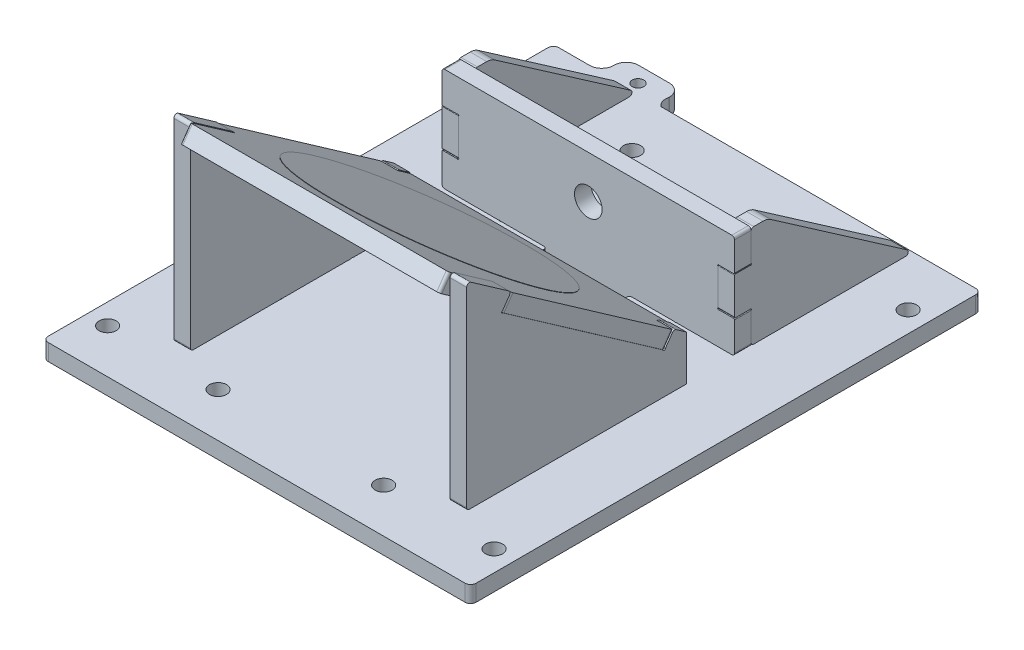
from build123d import *

# Parameters (mm, degrees)
BOSS_EXTRUDE1_DEPTH      = 6
BOSS_EXTRUDE2_DEPTH      = 6
SKETCH4_R                = 42
BOSS_EXTRUDE3_DEPTH      = 6
SKETCH3_R                = 3.1
SKETCH3_R_2              = 2.1
BOSS_EXTRUDE5_DEPTH      = 6
BOSS_EXTRUDE6_DEPTH      = 6
BODY_MOVE_COPY2_ANGLE    = 180
BODY_MOVE_COPY5_ANGLE    = 180
BODY_MOVE_COPY8_START    = 396.020080662
BODY_MOVE_COPY8_DEPTH    = 6
BODY_MOVE_COPY8_2_DEPTH  = 6
BODY_MOVE_COPY9_ANGLE    = 180
BODY_MOVE_COPY10_START   = 396.020080662
BODY_MOVE_COPY10_DEPTH   = 6
BODY_MOVE_COPY10_2_DEPTH = 6
BODY_MOVE_COPY15_ANGLE   = 90
BODY_MOVE_COPY17_ANGLE   = 35
SKETCH8_R                = 41.964596681
BOSS_EXTRUDE7_DEPTH      = 0.1
FILLET1_R                = 2
BODY_MOVE_COPY19_START   = 295.92104831
BODY_MOVE_COPY19_DEPTH   = 6
BODY_MOVE_COPY19_2_DEPTH = 6
BODY_MOVE_COPY20_START   = 374.882569364
BODY_MOVE_COPY20_DEPTH   = 6
BODY_MOVE_COPY20_2_DEPTH = 6
BODY_MOVE_COPY21_START   = 295.92104831
BODY_MOVE_COPY21_DEPTH   = 6
BODY_MOVE_COPY21_2_DEPTH = 6
BODY_MOVE_COPY22_START   = 396.020080662
BODY_MOVE_COPY22_DEPTH   = 6
BODY_MOVE_COPY22_2_DEPTH = 6


# Read off the part's stored shape, not the designer's step: Body-Move/Copy8, Body-Move/Copy10, Body-Move/Copy19, Body-Move/Copy20, Body-Move/Copy21, Body-Move/Copy22
with BuildPart() as part:
    # Sketch6 → Boss-Extrude1 (new body)
    with BuildSketch(Plane(origin=(259.180115074, 0, 0), x_dir=(0, 0, -1), z_dir=(1, 0, 0))):
        with BuildLine():
            Line((0, 229.491923688), (0, 216.402331063))
            ThreePointArc((0, 216.402331063), (-0.100890866, 216.158758965), (-0.344462964, 216.057868099))
            Line((-0.344462964, 216.057868099), (-5.417934935, 216.057868099))
            ThreePointArc((-5.417934935, 216.057868099), (-5.90507938, 216.057868099), (-5.90507938, 215.570723655))
            Line((-5.90507938, 215.570723655), (-5.90507938, 205.47793421))
            ThreePointArc((-5.90507938, 205.47793421), (-6.193338998, 204.782013932), (-6.889259276, 204.493754314))
            Line((-6.889259276, 204.493754314), (-61.889259165, 204.493754314))
            ThreePointArc((-61.889259165, 204.493754314), (-62.828563719, 205.184136264), (-62.450062585, 206.286704708))
            Line((-62.450062585, 206.286704708), (-13.075004127, 240.523454428))
            ThreePointArc((-13.075004127, 240.523454428), (-11.73997764, 241.176123509), (-10.270988993, 241.400500438))
            Line((-10.270988993, 241.400500438), (-6.889259276, 241.400500438))
            ThreePointArc((-6.889259276, 241.400500438), (-6.193338998, 241.11224082), (-5.90507938, 240.416320541))
            Line((-5.90507938, 240.416320541), (-5.90507938, 230.323531096))
            ThreePointArc((-5.90507938, 230.323531096), (-5.90507938, 229.836386652), (-5.417934935, 229.836386652))
            Line((-5.417934935, 229.836386652), (-0.344462964, 229.836386652))
            ThreePointArc((-0.344462964, 229.836386652), (-0.100890866, 229.735495786), (0, 229.491923688))
        make_face()
    extrude(amount=BOSS_EXTRUDE1_DEPTH)


with BuildPart() as body_2:
    # Sketch5 → Boss-Extrude2 (new body)
    with BuildSketch(Plane(origin=(256.769204052, 0, 0), x_dir=(0, 0, -1), z_dir=(1, 0, 0))):
        with BuildLine():
            Line((-12, 208.780869141), (-12, 277.928876141))
            ThreePointArc((-12, 277.928876141), (-12.538251537, 278.815887402), (-13.573577, 278.748028141))
            Line((-13.573577, 278.748028141), (-27.31886, 269.123477141))
            ThreePointArc((-27.31886, 269.123477141), (-27.730091296, 268.477973575), (-27.564436, 267.730749141))
            Line((-27.564436, 267.730749141), (-24.98046, 264.040448141))
            ThreePointArc((-24.98046, 264.040448141), (-24.696554, 263.634989141), (-25.102013, 263.351083141))
            Line((-25.102013, 263.351083141), (-83.270041, 222.621391141))
            ThreePointArc((-83.270041, 222.621391141), (-83.675501, 222.337485141), (-83.959407, 222.742945141))
            Line((-83.959407, 222.742945141), (-86.543383, 226.433245141))
            ThreePointArc((-86.543383, 226.433245141), (-87.188887016, 226.844476928), (-87.936112, 226.678821141))
            Line((-87.936112, 226.678821141), (-91.592045, 224.118909141))
            Line((-91.592045, 224.118909141), (-91.592045, 207.780869141))
            Line((-91.592045, 207.780869141), (-70.744975, 207.780869141))
            ThreePointArc((-70.744975, 207.780869141), (-70.25, 207.780869141), (-70.25, 207.285894141))
            Line((-70.25, 207.285894141), (-70.25, 202.780869141))
            ThreePointArc((-70.25, 202.780869141), (-69.957106781, 202.07376236), (-69.25, 201.780869141))
            Line((-69.25, 201.780869141), (-46.25, 201.780869141))
            ThreePointArc((-46.25, 201.780869141), (-45.542893219, 202.07376236), (-45.25, 202.780869141))
            Line((-45.25, 202.780869141), (-45.25, 207.285894141))
            ThreePointArc((-45.25, 207.285894141), (-45.2500005, 207.780868641), (-44.755026, 207.780869141))
            Line((-44.755026, 207.780869141), (-13, 207.780869141))
            ThreePointArc((-13, 207.780869141), (-12.292893219, 208.07376236), (-12, 208.780869141))
        make_face()
    extrude(amount=BOSS_EXTRUDE2_DEPTH)


with BuildPart() as body_3:
    # Sketch4 → Boss-Extrude3 (new body)
    # profile 1 of 2: a face of its own
    with BuildSketch(Plane(origin=(0, 97.256150076, 0), x_dir=(-1, 0, 0), z_dir=(0, 1, 0))):
        with BuildLine():
            Line((-113.209223251, -57.967223344), (-113.209223251, 34.032776656))
            ThreePointArc((-113.209223251, 34.032776656), (-113.502116469, 34.739883437), (-114.209223251, 35.032776656))
            Line((-114.209223251, 35.032776656), (-118.214249251, 35.032776656))
            ThreePointArc((-118.214249251, 35.032776656), (-118.709223751, 35.032777156), (-118.709223251, 35.527751656))
            Line((-118.709223251, 35.527751656), (-118.709223251, 40.032776656))
            ThreePointArc((-118.709223251, 40.032776656), (-119.002116469, 40.739883437), (-119.709223251, 41.032776656))
            Line((-119.709223251, 41.032776656), (-189.709223251, 41.032776656))
            ThreePointArc((-189.709223251, 41.032776656), (-190.416330032, 40.739883437), (-190.709223251, 40.032776656))
            Line((-190.709223251, 40.032776656), (-190.709223251, 35.527751656))
            ThreePointArc((-190.709223251, 35.527751656), (-190.709223251, 35.032776656), (-191.204198251, 35.032776656))
            Line((-191.204198251, 35.032776656), (-209.709223251, 35.032776656))
            ThreePointArc((-209.709223251, 35.032776656), (-210.416330032, 34.739883437), (-210.709223251, 34.032776656))
            Line((-210.709223251, 34.032776656), (-210.709223251, -57.967223344))
            ThreePointArc((-210.709223251, -57.967223344), (-210.416330032, -58.674330125), (-209.709223251, -58.967223344))
            Line((-209.709223251, -58.967223344), (-191.204198251, -58.967223344))
            ThreePointArc((-191.204198251, -58.967223344), (-190.709223751, -58.967222844), (-190.709223251, -59.462197344))
            Line((-190.709223251, -59.462197344), (-190.709223251, -63.967223344))
            ThreePointArc((-190.709223251, -63.967223344), (-190.416330032, -64.674330125), (-189.709223251, -64.967223344))
            Line((-189.709223251, -64.967223344), (-119.709223251, -64.967223344))
            ThreePointArc((-119.709223251, -64.967223344), (-119.002116469, -64.674330125), (-118.709223251, -63.967223344))
            Line((-118.709223251, -63.967223344), (-118.709223251, -59.462197344))
            ThreePointArc((-118.709223251, -59.462197344), (-118.709223251, -58.967223344), (-118.214249251, -58.967223344))
            Line((-118.214249251, -58.967223344), (-114.209223251, -58.967223344))
            ThreePointArc((-114.209223251, -58.967223344), (-113.502116469, -58.674330125), (-113.209223251, -57.967223344))
        make_face()
        with Locations((-161.959223251, -11.967223344)):
            Circle(SKETCH4_R, mode=Mode.SUBTRACT)
    # profile 2 of 2: a face of its own
    with BuildSketch(Plane(origin=(0, 97.256150076, 0), x_dir=(-1, 0, 0), z_dir=(0, 1, 0))):
        with Locations((-161.959223251, -11.967223344)):
            Circle(SKETCH4_R)
    extrude(amount=BOSS_EXTRUDE3_DEPTH)


with BuildPart() as body_4:
    # Sketch3 → Boss-Extrude5 (new body)
    with BuildSketch(Plane(origin=(-0.811032021, 207.780869141, 0), x_dir=(1, 0, 0), z_dir=(0, -1, 0))):
        with BuildLine():
            Line((272.134893953, -56), (272.134893953, -59))
            Line((272.134893953, -59), (285.234893953, -59))
            ThreePointArc((285.234893953, -59), (288.34616379, -60.288730163), (289.634893953, -63.4))
            Line((289.634893953, -63.4), (289.634893953, -63.530837911))
            ThreePointArc((289.634893953, -63.530837911), (290.923624116, -66.642107748), (294.034893953, -67.930837911))
            Line((294.034893953, -67.930837911), (299.634893953, -67.930837911))
            Line((299.634893953, -67.930837911), (305.234893953, -67.930837911))
            ThreePointArc((305.234893953, -67.930837911), (308.34616379, -66.642107748), (309.634893953, -63.530837911))
            Line((309.634893953, -63.530837911), (309.634893953, -63.4))
            ThreePointArc((309.634893953, -63.4), (309.711360462, -61.00160298), (311.034893953, -59))
            Line((311.034893953, -59), (427.134893953, -59))
            Line((427.134893953, -59), (427.134893953, -56))
            Line((427.134893953, -56), (427.134893953, 126))
            Line((427.134893953, 126), (272.134893953, 126))
            Line((272.134893953, 126), (272.134893953, -56))
        make_face()
        with Locations(Location((419.634893953, -40, 0), (0, 0, 270))):
            Circle(SKETCH3_R, mode=Mode.SUBTRACT)
        with Locations(Location((379.634893953, -40, 0), (0, 0, 270))):
            Circle(SKETCH3_R, mode=Mode.SUBTRACT)
        with Locations(Location((319.634893953, -40, 0), (0, 0, 270))):
            Circle(SKETCH3_R, mode=Mode.SUBTRACT)
        with Locations(Location((279.634893953, -40, 0), (0, 0, 270))):
            Circle(SKETCH3_R, mode=Mode.SUBTRACT)
        with Locations(Location((279.634893953, 110, 0), (0, 0, 270))):
            Circle(SKETCH3_R, mode=Mode.SUBTRACT)
        with Locations(Location((319.634893953, 110, 0), (0, 0, 270))):
            Circle(SKETCH3_R, mode=Mode.SUBTRACT)
        with Locations(Location((379.634893953, 110, 0), (0, 0, 270))):
            Circle(SKETCH3_R, mode=Mode.SUBTRACT)
        with Locations(Location((419.634893953, 110, 0), (0, 0, 270))):
            Circle(SKETCH3_R, mode=Mode.SUBTRACT)
        with Locations(Location((299.634893953, -62.135677, 0), (0, 0, 270))):
            Circle(SKETCH3_R_2, mode=Mode.SUBTRACT)
        with BuildLine():
            Line((318.129868953, 6), (333.634893953, 6))
            ThreePointArc((333.634893953, 6), (334.342000734, 6.292893219), (334.634893953, 7))
            Line((334.634893953, 7), (334.634893953, 22))
            ThreePointArc((334.634893953, 22), (335.220680391, 23.414213562), (336.634893953, 24))
            Line((336.634893953, 24), (362.634893953, 24))
            ThreePointArc((362.634893953, 24), (364.049107515, 23.414213562), (364.634893953, 22))
            Line((364.634893953, 22), (364.634893953, 7))
            ThreePointArc((364.634893953, 7), (364.927787172, 6.292893219), (365.634893953, 6))
            Line((365.634893953, 6), (381.139918953, 6))
            ThreePointArc((381.139918953, 6), (381.634893953, 6), (381.634893953, 5.505025))
            Line((381.634893953, 5.505025), (381.634893953, 0.494975))
            ThreePointArc((381.634893953, 0.494975), (381.634893953, 0), (381.139918953, 0))
            Line((381.139918953, 0), (318.129868953, 0))
            ThreePointArc((318.129868953, 0), (317.634893953, 0), (317.634893953, 0.494975))
            Line((317.634893953, 0.494975), (317.634893953, 5.505025))
            ThreePointArc((317.634893953, 5.505025), (317.634893953, 6), (318.129868953, 6))
        make_face(mode=Mode.SUBTRACT)
        with BuildLine():
            Line((402.139918953, 45.25), (397.129868953, 45.25))
            ThreePointArc((397.129868953, 45.25), (396.634893953, 45.25), (396.634893953, 45.744975))
            Line((396.634893953, 45.744975), (396.634893953, 69.755025))
            ThreePointArc((396.634893953, 69.755025), (396.634893953, 70.25), (397.129868953, 70.25))
            Line((397.129868953, 70.25), (402.139918953, 70.25))
            ThreePointArc((402.139918953, 70.25), (402.634893953, 70.25), (402.634893953, 69.755025))
            Line((402.634893953, 69.755025), (402.634893953, 45.744975))
            ThreePointArc((402.634893953, 45.744975), (402.634893953, 45.25), (402.139918953, 45.25))
        make_face(mode=Mode.SUBTRACT)
        with BuildLine():
            Line((297.129869326, 45.25), (302.13991858, 45.25))
            ThreePointArc((302.13991858, 45.25), (302.634893953, 45.249999627), (302.634894326, 45.744975))
            Line((302.634894326, 45.744975), (302.634894326, 69.755025))
            ThreePointArc((302.634894326, 69.755025), (302.634894326, 70.25), (302.139919326, 70.25))
            Line((302.139919326, 70.25), (297.129869326, 70.25))
            ThreePointArc((297.129869326, 70.25), (296.634894326, 70.25), (296.634894326, 69.755025))
            Line((296.634894326, 69.755025), (296.634894326, 45.744975))
            ThreePointArc((296.634894326, 45.744975), (296.634894326, 45.25), (297.129869326, 45.25))
        make_face(mode=Mode.SUBTRACT)
    extrude(amount=BOSS_EXTRUDE5_DEPTH)

    # Fillet1
    fillet1_edges = [body_4.edges().sort_by_distance(p)[0] for p in [
        (271.323861932, 204.780869141, -59),
        (271.323861932, 204.780869141, 126),
        (426.323861932, 204.780869141, 126),
        (426.323861932, 204.780869141, -59),
    ]]
    fillet(fillet1_edges, radius=FILLET1_R)


with BuildPart() as body_5:
    # Sketch2 → Boss-Extrude6 (new body)
    with BuildSketch(Plane(origin=(14.444060441, 0, 0), x_dir=(1, 0, 0), z_dir=(0, 0, 1))):
        with BuildLine():
            Line((334.511507872, 164.280869297), (303.511507872, 164.280869297))
            ThreePointArc((303.511507872, 164.280869297), (302.804401091, 164.573762516), (302.511507872, 165.280869297))
            Line((302.511507872, 165.280869297), (302.511507872, 175.680869297))
            ThreePointArc((302.511507872, 175.680869297), (302.614020499, 175.928356671), (302.861507872, 176.030869297))
            Line((302.861507872, 176.030869297), (308.016532872, 176.030869297))
            ThreePointArc((308.016532872, 176.030869297), (308.511507372, 176.030868797), (308.511507872, 176.525843297))
            Line((308.511507872, 176.525843297), (308.511507872, 189.535894297))
            ThreePointArc((308.511507872, 189.535894297), (308.511507872, 190.030869297), (308.016532872, 190.030869297))
            Line((308.016532872, 190.030869297), (302.861507872, 190.030869297))
            ThreePointArc((302.861507872, 190.030869297), (302.614020499, 190.133381924), (302.511507872, 190.380869297))
            Line((302.511507872, 190.380869297), (302.511507872, 207.285894297))
            ThreePointArc((302.511507872, 207.285894297), (302.511507872, 207.780869044), (302.016533125, 207.780869044))
            Line((302.016533125, 207.780869044), (282.511507872, 207.780869297))
            ThreePointArc((282.511507872, 207.780869297), (281.804401091, 208.073762516), (281.511507872, 208.780869297))
            Line((281.511507872, 208.780869297), (281.511507872, 219.180869297))
            ThreePointArc((281.511507872, 219.180869297), (281.614020499, 219.428356671), (281.861507872, 219.530869297))
            Line((281.861507872, 219.530869297), (287.016532872, 219.530869297))
            ThreePointArc((287.016532872, 219.530869297), (287.511507372, 219.530868797), (287.511507872, 220.025843297))
            Line((287.511507872, 220.025843297), (287.511507872, 233.035894297))
            ThreePointArc((287.511507872, 233.035894297), (287.511507872, 233.530869297), (287.016532872, 233.530869297))
            Line((287.016532872, 233.530869297), (281.861507872, 233.530869297))
            ThreePointArc((281.861507872, 233.530869297), (281.614020499, 233.633381924), (281.511507872, 233.880869297))
            Line((281.511507872, 233.880869297), (281.511507872, 244.280869297))
            ThreePointArc((281.511507872, 244.280869297), (281.804401091, 244.987976079), (282.511507872, 245.280869297))
            Line((282.511507872, 245.280869297), (386.511507872, 245.280869297))
            ThreePointArc((386.511507872, 245.280869297), (387.218614653, 244.987976079), (387.511507872, 244.280869297))
            Line((387.511507872, 244.280869297), (387.511507872, 233.880869297))
            ThreePointArc((387.511507872, 233.880869297), (387.408995246, 233.633381924), (387.161507872, 233.530869297))
            Line((387.161507872, 233.530869297), (382.006481872, 233.530869297))
            ThreePointArc((382.006481872, 233.530869297), (381.511507372, 233.530868797), (381.511507872, 233.035894297))
            Line((381.511507872, 233.035894297), (381.511507872, 220.025843297))
            ThreePointArc((381.511507872, 220.025843297), (381.511507872, 219.530869297), (382.006481872, 219.530869297))
            Line((382.006481872, 219.530869297), (387.161507872, 219.530869297))
            ThreePointArc((387.161507872, 219.530869297), (387.408995246, 219.428356671), (387.511507872, 219.180869297))
            Line((387.511507872, 219.180869297), (387.511507872, 208.780869297))
            ThreePointArc((387.511507872, 208.780869297), (387.218614653, 208.073762516), (386.511507872, 207.780869297))
            Line((386.511507872, 207.780869297), (367.006482246, 207.780868671))
            ThreePointArc((367.006482246, 207.780868671), (366.511507872, 207.780868671), (366.511507872, 207.285894297))
            Line((366.511507872, 207.285894297), (366.511507872, 190.380869297))
            ThreePointArc((366.511507872, 190.380869297), (366.408995246, 190.133381924), (366.161507872, 190.030869297))
            Line((366.161507872, 190.030869297), (361.006481872, 190.030869297))
            ThreePointArc((361.006481872, 190.030869297), (360.511507372, 190.030868797), (360.511507872, 189.535894297))
            Line((360.511507872, 189.535894297), (360.511507872, 176.525843297))
            ThreePointArc((360.511507872, 176.525843297), (360.511507872, 176.030869297), (361.006481872, 176.030869297))
            Line((361.006481872, 176.030869297), (366.161507872, 176.030869297))
            ThreePointArc((366.161507872, 176.030869297), (366.408995246, 175.928356671), (366.511507872, 175.680869297))
            Line((366.511507872, 175.680869297), (366.511507872, 165.280869297))
            ThreePointArc((366.511507872, 165.280869297), (366.218614653, 164.573762516), (365.511507872, 164.280869297))
            Line((365.511507872, 164.280869297), (334.511507872, 164.280869297))
        make_face()
        with BuildLine():
            ThreePointArc((339.511507872, 229.780869297), (334.511507872, 234.780869297), (329.511507872, 229.780869297))
            ThreePointArc((329.511507872, 229.780869297), (330.975973966, 226.245335392), (334.511507872, 224.780869297))
            ThreePointArc((334.511507872, 224.780869297), (338.047041778, 226.245335392), (339.511507872, 229.780869297))
        make_face(mode=Mode.SUBTRACT)
        with BuildLine():
            ThreePointArc((339.511507872, 179.780869297), (334.511507872, 184.780869297), (329.511507872, 179.780869297))
            ThreePointArc((329.511507872, 179.780869297), (330.975973966, 176.245335392), (334.511507872, 174.780869297))
            ThreePointArc((334.511507872, 174.780869297), (338.047041778, 176.245335392), (339.511507872, 179.780869297))
        make_face(mode=Mode.SUBTRACT)
    extrude(amount=BOSS_EXTRUDE6_DEPTH)


with BuildPart() as body_2_1:
    # Body-Move/Copy1: moved
    add(body_2.part.moved(Location((39.090347222, 0, 0))))


with BuildPart() as body_2_2:
    # Body-Move/Copy2: moved
    add(body_2_1.part.rotate(Axis((298.859551273, 0, 51.7960225), (0, 1, 0)), BODY_MOVE_COPY2_ANGLE))


with BuildPart() as body_2_3:
    # Body-Move/Copy3: moved
    add(body_2_2.part.moved(Location((0, 0, 11.447860124))))


with BuildPart() as body_6:
    # Body-Move/Copy4: copy of body 2
    add(body_2_3.part.moved(Location((100.069066196, 0, 0))))


with BuildPart() as part_1:
    # Body-Move/Copy5: moved
    add(part.part.rotate(Axis((262.180115074, 0, 31.942046057), (0, 1, 0)), BODY_MOVE_COPY5_ANGLE))


with BuildPart() as body_7:
    # Body-Move/Copy6: copy of part
    add(part_1.part.moved(Location((36.740933236, 0, -58.148617023))))

    # Body-Move/Copy19 outline → Body-Move/Copy19 (cut)
    with BuildSketch(Plane.YZ.offset(BODY_MOVE_COPY19_START)):
        with BuildLine():
            ThreePointArc((216.13235483, 0.206230387), (216.152186866, 0.405459508), (216.057868099, 0.582065064))
            Line((216.057868099, 0.582065064), (216.057868099, 0.317540155))
            ThreePointArc((216.057868099, 0.317540155), (216.10057347, 0.265540359), (216.13235483, 0.206230387))
        make_face()
        with BuildLine():
            Line((229.836386652, 0.317540155), (229.836386652, 0.582065064))
            ThreePointArc((229.836386652, 0.582065064), (229.742067885, 0.405459508), (229.761899921, 0.206230387))
            ThreePointArc((229.761899921, 0.206230387), (229.793681281, 0.265540359), (229.836386652, 0.317540155))
        make_face()
        with BuildLine():
            ThreePointArc((206.286704708, -56.450062585), (205.184136264, -56.828563719), (204.493754314, -55.889259165))
            Line((204.493754314, -55.889259165), (204.493754314, -56.153784074))
            ThreePointArc((204.493754314, -56.153784074), (205.184136264, -57.093088628), (206.286704708, -56.714587494))
            Line((206.286704708, -56.714587494), (240.523454428, -7.339529036))
            ThreePointArc((240.523454428, -7.339529036), (241.176123509, -6.004502549), (241.400500438, -4.535513903))
            Line((241.400500438, -4.535513903), (241.400500438, -4.270988993))
            ThreePointArc((241.400500438, -4.270988993), (241.176123509, -5.73997764), (240.523454428, -7.075004127))
            Line((240.523454428, -7.075004127), (206.286704708, -56.450062585))
        make_face()
    extrude(amount=BODY_MOVE_COPY19_DEPTH, mode=Mode.SUBTRACT)

    # Body-Move_Copy19 2 outline → Body-Move_Copy19 2 (add)
    with BuildSketch(Plane.YZ.offset(BODY_MOVE_COPY19_START)):
        with BuildLine():
            Line((229.491923688, 6), (216.402331063, 6))
            ThreePointArc((216.402331063, 6), (216.158758965, 5.899109134), (216.057868099, 5.655537036))
            Line((216.057868099, 5.655537036), (216.057868099, 5.391012127))
            ThreePointArc((216.057868099, 5.391012127), (216.158758965, 5.634584225), (216.402331063, 5.735475091))
            Line((216.402331063, 5.735475091), (229.491923688, 5.735475091))
            ThreePointArc((229.491923688, 5.735475091), (229.735495786, 5.634584225), (229.836386652, 5.391012127))
            Line((229.836386652, 5.391012127), (229.836386652, 5.655537036))
            ThreePointArc((229.836386652, 5.655537036), (229.735495786, 5.899109134), (229.491923688, 6))
        make_face()
        with BuildLine():
            ThreePointArc((215.570723655, -0.169604289), (216.005868303, -0.21230966), (216.13235483, 0.206230387))
            ThreePointArc((216.13235483, 0.206230387), (215.881262543, 0.000601853), (215.570723655, 0.09492062))
            Line((215.570723655, 0.09492062), (205.47793421, 0.09492062))
            ThreePointArc((205.47793421, 0.09492062), (204.782013932, -0.193338998), (204.493754314, -0.889259277))
            Line((204.493754314, -0.889259277), (204.493754314, -1.153784186))
            ThreePointArc((204.493754314, -1.153784186), (204.782013932, -0.457863907), (205.47793421, -0.169604289))
            Line((205.47793421, -0.169604289), (215.570723655, -0.169604289))
        make_face()
        with BuildLine():
            ThreePointArc((230.323531096, 0.09492062), (230.012992208, 0.000601853), (229.761899921, 0.206230387))
            ThreePointArc((229.761899921, 0.206230387), (229.888386448, -0.21230966), (230.323531096, -0.169604289))
            Line((230.323531096, -0.169604289), (240.416320541, -0.169604289))
            ThreePointArc((240.416320541, -0.169604289), (241.11224082, -0.457863907), (241.400500438, -1.153784186))
            Line((241.400500438, -1.153784186), (241.400500438, -0.889259277))
            ThreePointArc((241.400500438, -0.889259277), (241.11224082, -0.193338998), (240.416320541, 0.09492062))
            Line((240.416320541, 0.09492062), (230.323531096, 0.09492062))
        make_face()
    extrude(amount=BODY_MOVE_COPY19_2_DEPTH)

    # Body-Move/Copy21 outline → Body-Move/Copy21 (cut)
    with BuildSketch(Plane.YZ.offset(BODY_MOVE_COPY21_START)):
        with BuildLine():
            ThreePointArc((219.752350745, 5.655537036), (219.853241611, 5.899109134), (220.096813708, 6))
            Line((220.096813708, 6), (216.402331063, 6))
            ThreePointArc((216.402331063, 6), (216.158758965, 5.899109134), (216.057868099, 5.655537036))
            Line((216.057868099, 5.655537036), (216.057868099, 0.582065064))
            ThreePointArc((216.057868099, 0.582065064), (216.158759017, 0.338492842), (216.057868099, 0.09492062))
            Line((216.057868099, 0.09492062), (219.2652063, 0.09492062))
            ThreePointArc((219.2652063, 0.09492062), (219.752350745, 0.094920619), (219.752350745, 0.582065064))
            Line((219.752350745, 0.582065064), (219.752350745, 5.655537036))
        make_face()
        with BuildLine():
            Line((234.018013742, 0.09492062), (233.530869297, 0.09492062))
            ThreePointArc((233.530869297, 0.09492062), (233.774441519, -0.005970298), (234.018013742, 0.09492062))
        make_face()
        with BuildLine():
            ThreePointArc((208.188236959, -0.889259277), (208.476496577, -0.193338998), (209.172416856, 0.09492062))
            Line((209.172416856, 0.09492062), (205.47793421, 0.09492062))
            ThreePointArc((205.47793421, 0.09492062), (204.782013932, -0.193338998), (204.493754314, -0.889259277))
            Line((204.493754314, -0.889259277), (204.493754314, -55.889259165))
            ThreePointArc((204.493754314, -55.889259165), (205.184136264, -56.828563719), (206.286704708, -56.450062585))
            Line((206.286704708, -56.450062585), (208.188236959, -53.707738421))
            Line((208.188236959, -53.707738421), (208.188236959, -0.889259277))
        make_face()
    extrude(amount=BODY_MOVE_COPY21_DEPTH, mode=Mode.SUBTRACT)

    # Body-Move_Copy21 2 outline → Body-Move_Copy21 2 (add)
    with BuildSketch(Plane.YZ.offset(BODY_MOVE_COPY21_START)):
        with BuildLine():
            Line((233.186406334, 6), (229.491923688, 6))
            ThreePointArc((229.491923688, 6), (229.735495786, 5.899109134), (229.836386652, 5.655537036))
            Line((229.836386652, 5.655537036), (229.836386652, 0.582065064))
            ThreePointArc((229.836386652, 0.582065064), (229.836386652, 0.09492062), (230.323531096, 0.09492062))
            Line((230.323531096, 0.09492062), (233.530869297, 0.09492062))
            ThreePointArc((233.530869297, 0.09492062), (233.429978379, 0.338492842), (233.530869297, 0.582065064))
            Line((233.530869297, 0.582065064), (233.530869297, 5.655537036))
            ThreePointArc((233.530869297, 5.655537036), (233.429978431, 5.899109134), (233.186406334, 6))
        make_face()
        with BuildLine():
            ThreePointArc((215.570723655, 0.09492062), (215.814295877, -0.005970298), (216.057868099, 0.09492062))
            Line((216.057868099, 0.09492062), (215.570723655, 0.09492062))
        make_face()
        with BuildLine():
            Line((244.110803186, 0.09492062), (240.416320541, 0.09492062))
            ThreePointArc((240.416320541, 0.09492062), (241.11224082, -0.193338998), (241.400500438, -0.889259277))
            Line((241.400500438, -0.889259277), (241.400500438, -4.270988993))
            ThreePointArc((241.400500438, -4.270988993), (241.176123509, -5.73997764), (240.523454428, -7.075004127))
            Line((240.523454428, -7.075004127), (208.188236959, -53.707738421))
            Line((208.188236959, -53.707738421), (208.188236959, -55.889259165))
            ThreePointArc((208.188236959, -55.889259165), (208.87861891, -56.828563719), (209.981187354, -56.450062585))
            Line((209.981187354, -56.450062585), (244.217937073, -7.075004127))
            ThreePointArc((244.217937073, -7.075004127), (244.870606155, -5.73997764), (245.094983083, -4.270988993))
            Line((245.094983083, -4.270988993), (245.094983083, -0.889259277))
            ThreePointArc((245.094983083, -0.889259277), (244.806723465, -0.193338998), (244.110803186, 0.09492062))
        make_face()
    extrude(amount=BODY_MOVE_COPY21_2_DEPTH)


with BuildPart() as part_2:
    # Body-Move/Copy7: moved
    add(part_1.part.moved(Location((136.839965587, 0, -57.873405281))))

    # Body-Move/Copy22 outline → Body-Move/Copy22 (cut)
    with BuildSketch(Plane.YZ.offset(BODY_MOVE_COPY22_START)):
        with BuildLine():
            ThreePointArc((219.752350745, 5.666223868), (219.853241611, 5.909795966), (220.096813708, 6.010686832))
            Line((220.096813708, 6.010686832), (216.402331063, 6.010686832))
            ThreePointArc((216.402331063, 6.010686832), (216.158758965, 5.909795966), (216.057868099, 5.666223868))
            Line((216.057868099, 5.666223868), (216.057868099, 0.592751897))
            ThreePointArc((216.057868099, 0.592751897), (216.158759017, 0.349179675), (216.057868099, 0.105607452))
            Line((216.057868099, 0.105607452), (219.2652063, 0.105607452))
            ThreePointArc((219.2652063, 0.105607452), (219.752350745, 0.105607452), (219.752350745, 0.592751897))
            Line((219.752350745, 0.592751897), (219.752350745, 5.666223868))
        make_face()
        with BuildLine():
            Line((234.018013742, 0.105607452), (233.530869297, 0.105607452))
            ThreePointArc((233.530869297, 0.105607452), (233.774441519, 0.004716534), (234.018013742, 0.105607452))
        make_face()
        with BuildLine():
            ThreePointArc((208.188236959, -0.878572444), (208.476496577, -0.182652165), (209.172416856, 0.105607452))
            Line((209.172416856, 0.105607452), (205.47793421, 0.105607452))
            ThreePointArc((205.47793421, 0.105607452), (204.782013931, -0.182652166), (204.493754314, -0.878572444))
            Line((204.493754314, -0.878572444), (204.493754314, -55.878572332))
            ThreePointArc((204.493754314, -55.878572332), (205.184136264, -56.817876887), (206.286704708, -56.439375753))
            Line((206.286704708, -56.439375753), (208.188236959, -53.697051589))
            Line((208.188236959, -53.697051589), (208.188236959, -0.878572444))
        make_face()
    extrude(amount=BODY_MOVE_COPY22_DEPTH, mode=Mode.SUBTRACT)

    # Body-Move_Copy22 2 outline → Body-Move_Copy22 2 (add)
    with BuildSketch(Plane.YZ.offset(BODY_MOVE_COPY22_START)):
        with BuildLine():
            Line((233.186406334, 6.010686832), (229.491923688, 6.010686832))
            ThreePointArc((229.491923688, 6.010686832), (229.735495786, 5.909795966), (229.836386652, 5.666223868))
            Line((229.836386652, 5.666223868), (229.836386652, 0.592751897))
            ThreePointArc((229.836386652, 0.592751897), (229.836386651, 0.105607452), (230.323531096, 0.105607452))
            Line((230.323531096, 0.105607452), (233.530869297, 0.105607452))
            ThreePointArc((233.530869297, 0.105607452), (233.429978379, 0.349179674), (233.530869297, 0.592751897))
            Line((233.530869297, 0.592751897), (233.530869297, 5.666223868))
            ThreePointArc((233.530869297, 5.666223868), (233.429978431, 5.909795966), (233.186406334, 6.010686832))
        make_face()
        with BuildLine():
            ThreePointArc((215.570723655, 0.105607452), (215.814295877, 0.004716534), (216.057868099, 0.105607452))
            Line((216.057868099, 0.105607452), (215.570723655, 0.105607452))
        make_face()
        with BuildLine():
            Line((244.110803186, 0.105607452), (240.416320541, 0.105607452))
            ThreePointArc((240.416320541, 0.105607452), (241.11224082, -0.182652165), (241.400500438, -0.878572444))
            Line((241.400500438, -0.878572444), (241.400500438, -4.260302161))
            ThreePointArc((241.400500438, -4.260302161), (241.176123509, -5.729290807), (240.523454428, -7.064317294))
            Line((240.523454428, -7.064317294), (208.188236959, -53.697051589))
            Line((208.188236959, -53.697051589), (208.188236959, -55.878572332))
            ThreePointArc((208.188236959, -55.878572332), (208.878618909, -56.817876887), (209.981187354, -56.439375753))
            Line((209.981187354, -56.439375753), (244.217937073, -7.064317294))
            ThreePointArc((244.217937073, -7.064317294), (244.870606155, -5.729290808), (245.094983083, -4.260302161))
            Line((245.094983083, -4.260302161), (245.094983083, -0.878572444))
            ThreePointArc((245.094983083, -0.878572444), (244.806723465, -0.182652165), (244.110803186, 0.105607452))
        make_face()
    extrude(amount=BODY_MOVE_COPY22_2_DEPTH)


with BuildPart() as body_8:
    # Body-Move/Copy8 outline → Body-Move/Copy8 (new body)
    with BuildSketch(Plane.YZ.offset(BODY_MOVE_COPY8_START)):
        with BuildLine():
            Line((223.491923688, -2.802780135), (210.402331063, -2.802780135))
            ThreePointArc((210.402331063, -2.802780135), (210.158758965, -2.903671001), (210.057868099, -3.147243099))
            Line((210.057868099, -3.147243099), (210.057868099, -8.22071507))
            ThreePointArc((210.057868099, -8.22071507), (210.0578681, -8.707859514), (209.570723655, -8.707859515))
            Line((209.570723655, -8.707859515), (199.47793421, -8.707859515))
            ThreePointArc((199.47793421, -8.707859515), (198.782013931, -8.996119133), (198.493754314, -9.692039411))
            Line((198.493754314, -9.692039411), (198.493754314, -64.692039299))
            ThreePointArc((198.493754314, -64.692039299), (199.184136264, -65.631343854), (200.286704708, -65.25284272))
            Line((200.286704708, -65.25284272), (234.523454428, -15.877784262))
            ThreePointArc((234.523454428, -15.877784262), (235.176123509, -14.542757775), (235.400500438, -13.073769128))
            Line((235.400500438, -13.073769128), (235.400500438, -9.692039411))
            ThreePointArc((235.400500438, -9.692039411), (235.11224082, -8.996119132), (234.416320541, -8.707859515))
            Line((234.416320541, -8.707859515), (224.323531096, -8.707859515))
            ThreePointArc((224.323531096, -8.707859515), (223.836386651, -8.707859515), (223.836386652, -8.22071507))
            Line((223.836386652, -8.22071507), (223.836386652, -3.147243099))
            ThreePointArc((223.836386652, -3.147243099), (223.735495786, -2.903671001), (223.491923688, -2.802780135))
        make_face()
    extrude(amount=BODY_MOVE_COPY8_DEPTH)


with BuildPart() as body_9:
    # Body-Move_Copy8 2 outline → Body-Move_Copy8 2 (new body)
    with BuildSketch(Plane.YZ.offset(BODY_MOVE_COPY8_START)):
        with BuildLine():
            Line((217.491923688, -11.616247102), (204.402331063, -11.616247102))
            ThreePointArc((204.402331063, -11.616247102), (204.158758965, -11.717137968), (204.057868099, -11.960710066))
            Line((204.057868099, -11.960710066), (204.057868099, -17.034182037))
            ThreePointArc((204.057868099, -17.034182037), (204.0578681, -17.521326481), (203.570723655, -17.521326482))
            Line((203.570723655, -17.521326482), (193.47793421, -17.521326482))
            ThreePointArc((193.47793421, -17.521326482), (192.782013932, -17.8095861), (192.493754314, -18.505506378))
            Line((192.493754314, -18.505506378), (192.493754314, -73.505506267))
            ThreePointArc((192.493754314, -73.505506267), (193.184136264, -74.444810821), (194.286704708, -74.066309687))
            Line((194.286704708, -74.066309687), (228.523454428, -24.691251229))
            ThreePointArc((228.523454428, -24.691251229), (229.176123509, -23.356224742), (229.400500438, -21.887236095))
            Line((229.400500438, -21.887236095), (229.400500438, -18.505506378))
            ThreePointArc((229.400500438, -18.505506378), (229.11224082, -17.8095861), (228.416320541, -17.521326482))
            Line((228.416320541, -17.521326482), (218.323531096, -17.521326482))
            ThreePointArc((218.323531096, -17.521326482), (217.836386651, -17.521326482), (217.836386652, -17.034182037))
            Line((217.836386652, -17.034182037), (217.836386652, -11.960710066))
            ThreePointArc((217.836386652, -11.960710066), (217.735495786, -11.717137968), (217.491923688, -11.616247102))
        make_face()
    extrude(amount=BODY_MOVE_COPY8_2_DEPTH)


with BuildPart() as body_10:
    # Body-Move/Copy9: copy of body 9
    add(body_9.part.rotate(Axis((0, 214.530869141, -43.558293159), (1, 0, 0)), BODY_MOVE_COPY9_ANGLE))

    # Body-Move/Copy10 outline → Body-Move/Copy10 (cut)
    with BuildSketch(Plane.YZ.offset(BODY_MOVE_COPY10_START)):
        with BuildLine():
            ThreePointArc((201.780869141, -68.611079939), (201.492609523, -69.307000218), (200.796689244, -69.595259836))
            Line((200.796689244, -69.595259836), (210.738207185, -69.595259836))
            ThreePointArc((210.738207185, -69.595259836), (211.22535163, -69.595259836), (211.22535163, -70.08240428))
            Line((211.22535163, -70.08240428), (211.22535163, -75.155876252))
            ThreePointArc((211.22535163, -75.155876252), (211.326242496, -75.399448349), (211.569814593, -75.500339216))
            Line((211.569814593, -75.500339216), (224.659407219, -75.500339216))
            ThreePointArc((224.659407219, -75.500339216), (224.902979316, -75.399448349), (225.003870182, -75.155876252))
            Line((225.003870182, -75.155876252), (225.003870182, -70.08240428))
            ThreePointArc((225.003870182, -70.08240428), (225.003870183, -69.595259836), (225.491014627, -69.595259836))
            Line((225.491014627, -69.595259836), (235.583804071, -69.595259836))
            ThreePointArc((235.583804071, -69.595259836), (236.27972435, -69.307000218), (236.567983968, -68.611079939))
            Line((236.567983968, -68.611079939), (236.567983968, -13.611080051))
            ThreePointArc((236.567983968, -13.611080051), (235.877602017, -12.671775497), (234.775033573, -13.050276631))
            Line((234.775033573, -13.050276631), (201.780869141, -60.633321487))
            Line((201.780869141, -60.633321487), (201.780869141, -68.611079939))
        make_face()
    extrude(amount=BODY_MOVE_COPY10_DEPTH, mode=Mode.SUBTRACT)

    # Body-Move_Copy10 2 outline → Body-Move_Copy10 2 (add)
    with BuildSketch(Plane.YZ.offset(BODY_MOVE_COPY10_START)):
        with BuildLine():
            Line((176.782699766, -75.500339215), (189.872292392, -75.500339215))
            ThreePointArc((189.872292392, -75.500339215), (190.115864489, -75.399448349), (190.216755355, -75.155876252))
            Line((190.216755355, -75.155876252), (190.216755355, -70.08240428))
            ThreePointArc((190.216755355, -70.08240428), (190.216755355, -69.595259836), (190.7038998, -69.595259836))
            Line((190.7038998, -69.595259836), (200.645417741, -69.595259836))
            ThreePointArc((200.645417741, -69.595259836), (199.949497462, -69.307000218), (199.661237844, -68.611079939))
            Line((199.661237844, -68.611079939), (199.661237844, -65.229350222))
            ThreePointArc((199.661237844, -65.229350222), (199.885614772, -63.760361575), (200.538283854, -62.425335089))
            Line((200.538283854, -62.425335089), (201.780869141, -60.633321487))
            Line((201.780869141, -60.633321487), (201.780869141, -13.611080051))
            ThreePointArc((201.780869141, -13.611080051), (201.09048719, -12.671775497), (199.987918746, -13.050276631))
            Line((199.987918746, -13.050276631), (165.751169027, -62.425335089))
            ThreePointArc((165.751169027, -62.425335089), (165.098499945, -63.760361575), (164.874123017, -65.229350222))
            Line((164.874123017, -65.229350222), (164.874123017, -68.611079939))
            ThreePointArc((164.874123017, -68.611079939), (165.162382635, -69.307000218), (165.858302914, -69.595259836))
            Line((165.858302914, -69.595259836), (175.951092358, -69.595259836))
            ThreePointArc((175.951092358, -69.595259836), (176.438236803, -69.595259836), (176.438236803, -70.08240428))
            Line((176.438236803, -70.08240428), (176.438236803, -75.155876252))
            ThreePointArc((176.438236803, -75.155876252), (176.539127669, -75.399448349), (176.782699766, -75.500339215))
        make_face()
    extrude(amount=BODY_MOVE_COPY10_2_DEPTH)


with BuildPart() as body_11:
    # Body-Move/Copy11: copy of body 10
    add(body_10.part.moved(Location((0, 0, 75.59329493))))


with BuildPart() as body_10_1:
    # Body-Move/Copy12: moved
    add(body_10.part.moved(Location((-75.161122833, 0, 75.495803436))))


with BuildPart() as body_11_1:
    # Body-Move/Copy13: moved
    add(body_11.part.moved(Location((-21.137511297, 0, 0))))

    # Body-Move/Copy20 outline → Body-Move/Copy20 (cut)
    with BuildSketch(Plane.YZ.offset(BODY_MOVE_COPY20_START)):
        with BuildLine():
            ThreePointArc((190.119014431, 5.707985015), (190.133899966, 5.551507752), (190.216755355, 5.417934936))
            Line((190.216755355, 5.417934936), (190.216755355, 5.51089065))
            ThreePointArc((190.216755355, 5.51089065), (190.151727074, 5.60142502), (190.119014431, 5.707985015))
        make_face()
        with BuildLine():
            Line((176.438236803, 5.51089065), (176.438236803, 5.417934936))
            ThreePointArc((176.438236803, 5.417934936), (176.521092192, 5.551507752), (176.535977727, 5.707985015))
            ThreePointArc((176.535977727, 5.707985015), (176.503265084, 5.60142502), (176.438236803, 5.51089065))
        make_face()
        with BuildLine():
            ThreePointArc((199.987918746, 62.450062585), (201.09048719, 62.828563719), (201.780869141, 61.889259165))
            Line((201.780869141, 61.889259165), (201.780869141, 61.982214879))
            ThreePointArc((201.780869141, 61.982214879), (201.090487191, 62.921519434), (199.987918746, 62.5430183))
            Line((199.987918746, 62.5430183), (165.751169027, 13.167959841))
            ThreePointArc((165.751169027, 13.167959841), (165.098499945, 11.832933355), (164.874123017, 10.363944708))
            Line((164.874123017, 10.363944708), (164.874123017, 10.270988994))
            ThreePointArc((164.874123017, 10.270988994), (165.098499945, 11.739977641), (165.751169027, 13.075004127))
            Line((165.751169027, 13.075004127), (199.987918746, 62.450062585))
        make_face()
    extrude(amount=BODY_MOVE_COPY20_DEPTH, mode=Mode.SUBTRACT)

    # Body-Move_Copy20 2 outline → Body-Move_Copy20 2 (add)
    with BuildSketch(Plane.YZ.offset(BODY_MOVE_COPY20_START)):
        with BuildLine():
            Line((176.782699766, 0), (189.872292392, 0))
            ThreePointArc((189.872292392, 0), (190.115864489, 0.100890867), (190.216755355, 0.344462964))
            Line((190.216755355, 0.344462964), (190.216755355, 0.437418678))
            ThreePointArc((190.216755355, 0.437418678), (190.115864489, 0.193846581), (189.872292392, 0.092955715))
            Line((189.872292392, 0.092955715), (176.782699766, 0.092955715))
            ThreePointArc((176.782699766, 0.092955715), (176.539127669, 0.193846581), (176.438236803, 0.437418678))
            Line((176.438236803, 0.437418678), (176.438236803, 0.344462964))
            ThreePointArc((176.438236803, 0.344462964), (176.539127669, 0.100890867), (176.782699766, 0))
        make_face()
        with BuildLine():
            ThreePointArc((190.7038998, 5.998035094), (190.307289726, 6.063063376), (190.119014431, 5.707985015))
            ThreePointArc((190.119014431, 5.707985015), (190.350328172, 5.98793477), (190.7038998, 5.90507938))
            Line((190.7038998, 5.90507938), (200.796689244, 5.90507938))
            ThreePointArc((200.796689244, 5.90507938), (201.492609523, 6.193338998), (201.780869141, 6.889259277))
            Line((201.780869141, 6.889259277), (201.780869141, 6.982214991))
            ThreePointArc((201.780869141, 6.982214991), (201.492609523, 6.286294712), (200.796689244, 5.998035094))
            Line((200.796689244, 5.998035094), (190.7038998, 5.998035094))
        make_face()
        with BuildLine():
            ThreePointArc((175.951092358, 5.90507938), (176.304663986, 5.98793477), (176.535977727, 5.707985015))
            ThreePointArc((176.535977727, 5.707985015), (176.347702432, 6.063063376), (175.951092358, 5.998035094))
            Line((175.951092358, 5.998035094), (165.858302914, 5.998035094))
            ThreePointArc((165.858302914, 5.998035094), (165.162382635, 6.286294712), (164.874123017, 6.982214991))
            Line((164.874123017, 6.982214991), (164.874123017, 6.889259277))
            ThreePointArc((164.874123017, 6.889259277), (165.162382635, 6.193338998), (165.858302914, 5.90507938))
            Line((165.858302914, 5.90507938), (175.951092358, 5.90507938))
        make_face()
    extrude(amount=BODY_MOVE_COPY20_2_DEPTH)


with BuildPart() as body_10_2:
    # Body-Move/Copy14: moved
    add(body_10_1.part.moved(Location((-3.958900703, 0, 0))))


with BuildPart() as body_3_1:
    # Body-Move/Copy15: moved
    add(body_3.part.rotate(Axis((161.959223251, 0, -11.967223344), (0, -1, 0)), BODY_MOVE_COPY15_ANGLE))


with BuildPart() as body_3_2:
    # Body-Move/Copy17: moved
    add(body_3_1.part.rotate(Axis((0, 100.256150076, -11.967223344), (-1, 0, 0)), BODY_MOVE_COPY17_ANGLE))


with BuildPart() as body_3_3:
    # Body-Move/Copy18: moved
    add(body_3_2.part.moved(Location((186.833214954, 149.059698225, 77.045110764))))

    # Sketch8 → Boss-Extrude7 (add)
    with BuildSketch(Plane(origin=(0, 139.174296076, -97.450891237), x_dir=(1, 0, 0), z_dir=(0, 0.8191520442890478, -0.5735764363509661))):
        with Locations(Location((348.792438205, -196.310380313, 0), (0, 0, 270))):
            Circle(SKETCH8_R)
    extrude(amount=BOSS_EXTRUDE7_DEPTH)


solid = Compound([body_4.part, body_5.part, body_2_3.part, body_6.part, body_7.part, part_2.part, body_11_1.part, body_10_2.part, body_3_3.part])
